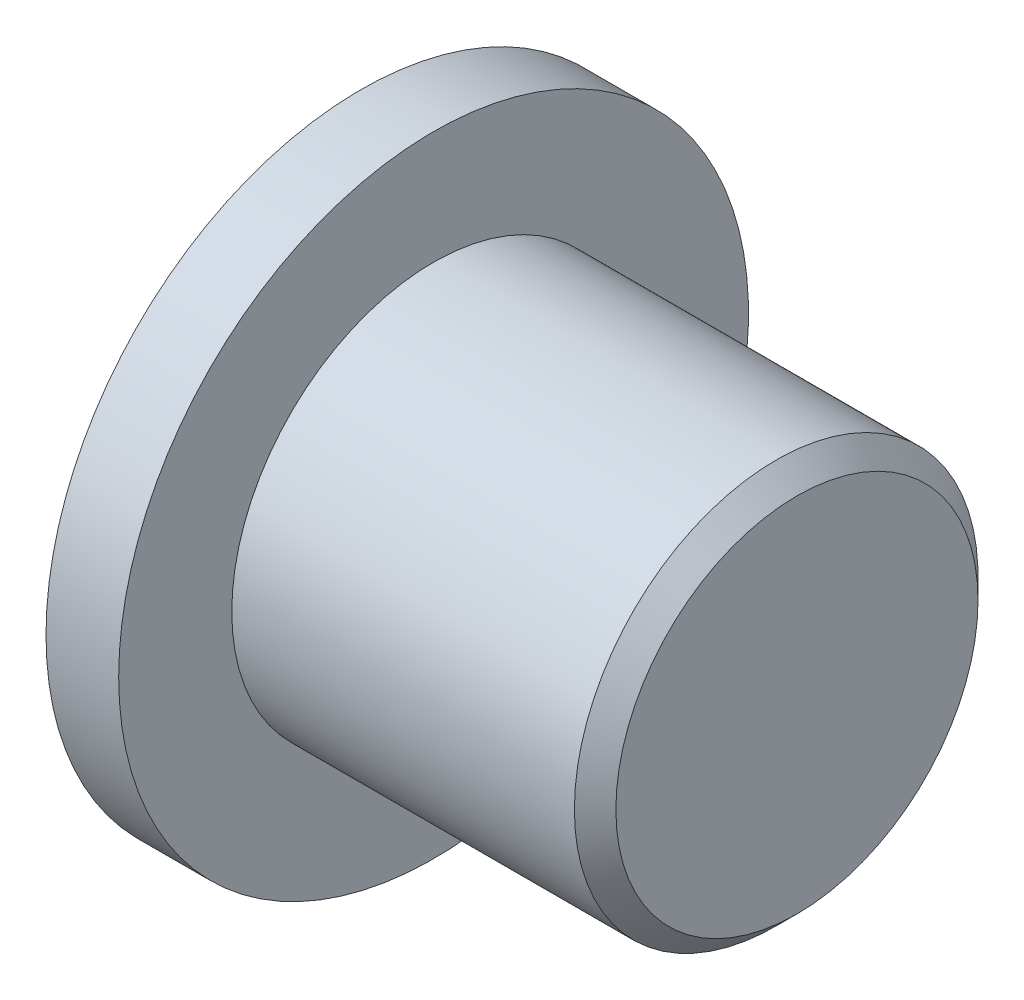
from build123d import *

# Parameters (mm, degrees)
SKETCH1_R           = 10
BOSS_EXTRUDE1_DEPTH = 15
SKETCH2_R           = 13
BOSS_EXTRUDE2_DEPTH = 3


# Read off the part's stored shape, not the designer's step: G3/8 Straight Pipe Tapped Thread Stud1
with BuildPart() as part:
    # Sketch1 → Boss-Extrude1 (new body)
    with BuildSketch(Plane(origin=(0, 0, 0), x_dir=(0, 0, -1), z_dir=(1, 0, 0))):
        Circle(SKETCH1_R)
    extrude(amount=BOSS_EXTRUDE1_DEPTH)

    # Sketch2 → Boss-Extrude2 (add)
    with BuildSketch(Plane.ZY):
        Circle(SKETCH2_R)
    extrude(amount=BOSS_EXTRUDE2_DEPTH)

    # G3/8 Straight Pipe Tapped Thread Stud1 o → G3/8 Straight Pipe Tapped Thread Stud1 (revolve, cut)
    with BuildSketch(Plane.YX):
        Polygon((10, 15), (7.475, 15), (8.331, 14.144), (8.331, 0), (10, 0), align=None)
    revolve(axis=Axis((0, 0, 0), (1, 0, 0)), mode=Mode.SUBTRACT)


solid = part.part
